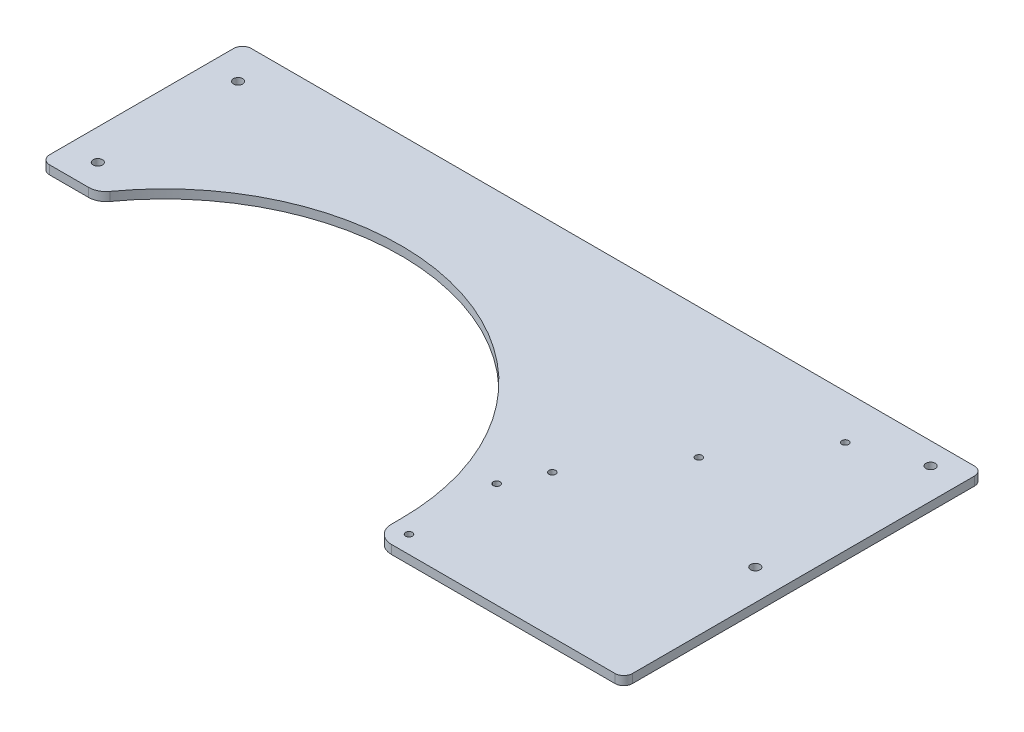
from build123d import *

# Parameters (mm, degrees)
BOSS_EXTRUDE1_DEPTH              = 6.35
F_17_64_0_26563_DIAMETER_HOLE1_D = 6.747002
FILLET1_R                        = 6.35
F_10_0_1935_DIAMETER_HOLE1_D     = 4.9149
SKETCH8_R                        = 3.373501
CUT_EXTRUDE1_DEPTH               = 299.268395545
FILLET2_R                        = 12.7


with BuildPart() as part:
    # Sketch1 → Boss-Extrude1 (new body)
    with BuildSketch(Plane(origin=(0, 0, 0), x_dir=(1, 0, 0), z_dir=(0, 1, 0))):
        with BuildLine():
            Line((-268.2875, -15.875), (-233.3625, -15.875))
            ThreePointArc((-233.3625, -15.875), (-228.872371939, -17.734871939), (-227.0125, -22.225))
            Line((-227.0125, -22.225), (-227.0125, -130.175))
            Line((-227.0125, -130.175), (268.2875, -130.175))
            Line((268.2875, -130.175), (268.2875, 130.175))
            Line((268.2875, 130.175), (-268.2875, 130.175))
            Line((-268.2875, 130.175), (-268.2875, -15.875))
        make_face()
    extrude(amount=BOSS_EXTRUDE1_DEPTH)

    # 17/64 (0.26563) Diameter Hole1 (through all)
    with Locations(Plane(origin=(0, 6.35, 0), x_dir=(1, 0, 0), z_dir=(0, 1, 0))):
        with Locations((-246.0625, 104.775), (-246.0625, 3.175), (-220.6625, -53.975), (-220.6625, -117.475), (246.0625, 114.3381), (246.0625, -12.6619)):
            Hole(F_17_64_0_26563_DIAMETER_HOLE1_D / 2)

    # Fillet1
    fillet1_edges = [part.edges().sort_by_distance(p)[0] for p in [
        (268.2875, 3.175, -130.175),
        (268.2875, 3.175, 130.175),
        (-227.0125, 3.175, 130.175),
        (-268.2875, 3.175, 15.875),
        (-268.2875, 3.175, -130.175),
    ]]
    fillet(fillet1_edges, radius=FILLET1_R)

    # #10 (0.1935) Diameter Hole1 (through all)
    with Locations(Plane(origin=(0, 6.35, 0), x_dir=(1, 0, 0), z_dir=(0, 1, 0))):
        with Locations((200.4455889, 98.15353155), (156.73906445, 35.734145775), (113.03254, -26.68524), (100.0125, -53.975), (100.0125, -117.475)):
            Hole(F_10_0_1935_DIAMETER_HOLE1_D / 2)

    # Sketch8 → Cut-Extrude1 (cut, through all)
    with BuildSketch(Plane(origin=(0, 6.35, 0), x_dir=(1, 0, 0), z_dir=(0, 1, 0))):
        with BuildLine():
            Line((-220.6625, -130.175), (87.3125, -130.175))
            Line((87.3125, -130.175), (87.3125, -110.647553384))
            ThreePointArc((87.3125, -110.647553384), (-34.644148174, 53.50332424), (-227.0125, -15.875))
            Line((-227.0125, -15.875), (-233.3625, -15.875))
            ThreePointArc((-233.3625, -15.875), (-228.872371939, -17.734871939), (-227.0125, -22.225))
            Line((-227.0125, -22.225), (-227.0125, -123.825))
            ThreePointArc((-227.0125, -123.825), (-225.152628061, -128.315128061), (-220.6625, -130.175))
        make_face()
        with Locations((-220.6625, -117.475)):
            Circle(SKETCH8_R, mode=Mode.SUBTRACT)
        with Locations((-220.6625, -53.975)):
            Circle(SKETCH8_R, mode=Mode.SUBTRACT)
    extrude(amount=-CUT_EXTRUDE1_DEPTH, mode=Mode.SUBTRACT)

    # Fillet2
    fillet2_edges = [part.edges().sort_by_distance(p)[0] for p in [
        (87.3125, 3.175, 130.175),
        (-227.0125, 3.175, 15.875),
    ]]
    fillet(fillet2_edges, radius=FILLET2_R)


solid = part.part
